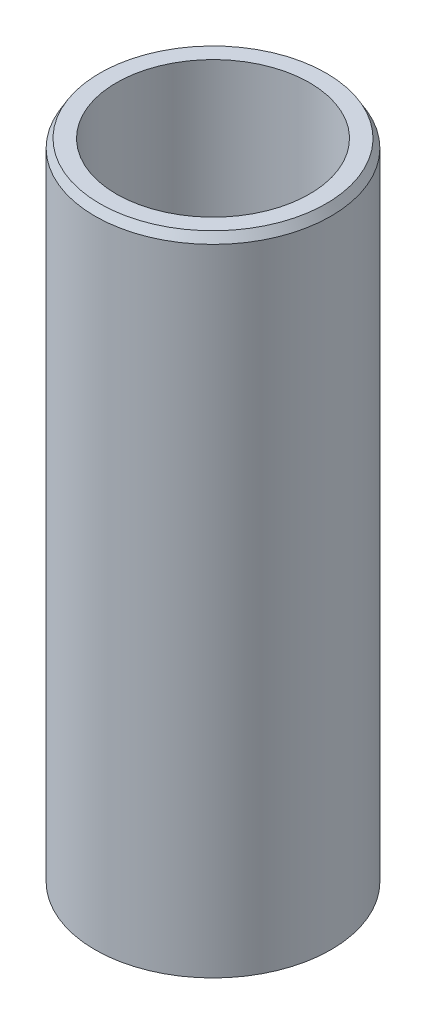
from build123d import *
from OCP.BRepFilletAPI import BRepFilletAPI_MakeChamfer

# Parameters (mm, degrees)
SKETCH1_R           = 57.5
BOSS_EXTRUDE1_DEPTH = 315.976727861
SKETCH2_R           = 47.034517916
CUT_EXTRUDE1_DEPTH  = 327.272574008
CHAMFER1_SIZE       = 4.088645032
CHAMFER1_SIZE2      = 2.36058031


with BuildPart() as part:
    # Sketch1 → Boss-Extrude1 (new body)
    with BuildSketch(Plane(origin=(0, 0, 0), x_dir=(1, 0, 0), z_dir=(0, 1, 0))):
        Circle(SKETCH1_R)
    extrude(amount=BOSS_EXTRUDE1_DEPTH)

    # Sketch2 → Cut-Extrude1 (cut, through all)
    with BuildSketch(Plane(origin=(0, 0, 0), x_dir=(1, 0, 0), z_dir=(0, 1, 0))):
        Circle(SKETCH2_R)
    extrude(amount=CUT_EXTRUDE1_DEPTH, mode=Mode.SUBTRACT)

    # Chamfer1: one chamfer whose edges measure the first distance from different faces: ONE call of the kernel's chamfer builder (chamfer() names one face for all edges)
    chamfer1_edges_1 = [part.edges().sort_by_distance(p)[0] for p in [
        (-57.5, 315.976727861, 0),
    ]]
    chamfer1_side_1 = [part.faces().sort_by_distance(p)[0] for p in [
        (-57.5, 157.98836393, 0),
    ]]
    chamfer1_edges_2 = [part.edges().sort_by_distance(p)[0] for p in [
        (-57.5, 0, 0),
    ]]
    chamfer1_side_2 = [part.faces().sort_by_distance(p)[0] for p in [
        (-55.873654403, 0, 0),
    ]]
    chamfer1 = BRepFilletAPI_MakeChamfer(part.part.solid().wrapped)
    for e in chamfer1_edges_1:
        chamfer1.Add(CHAMFER1_SIZE, CHAMFER1_SIZE2, e.wrapped, chamfer1_side_1[0].wrapped)  # the first distance lies on this face
    for e in chamfer1_edges_2:
        chamfer1.Add(CHAMFER1_SIZE, CHAMFER1_SIZE2, e.wrapped, chamfer1_side_2[0].wrapped)  # the first distance lies on this face
    add(Compound.cast(chamfer1.Shape()), mode=Mode.REPLACE)


solid = part.part
